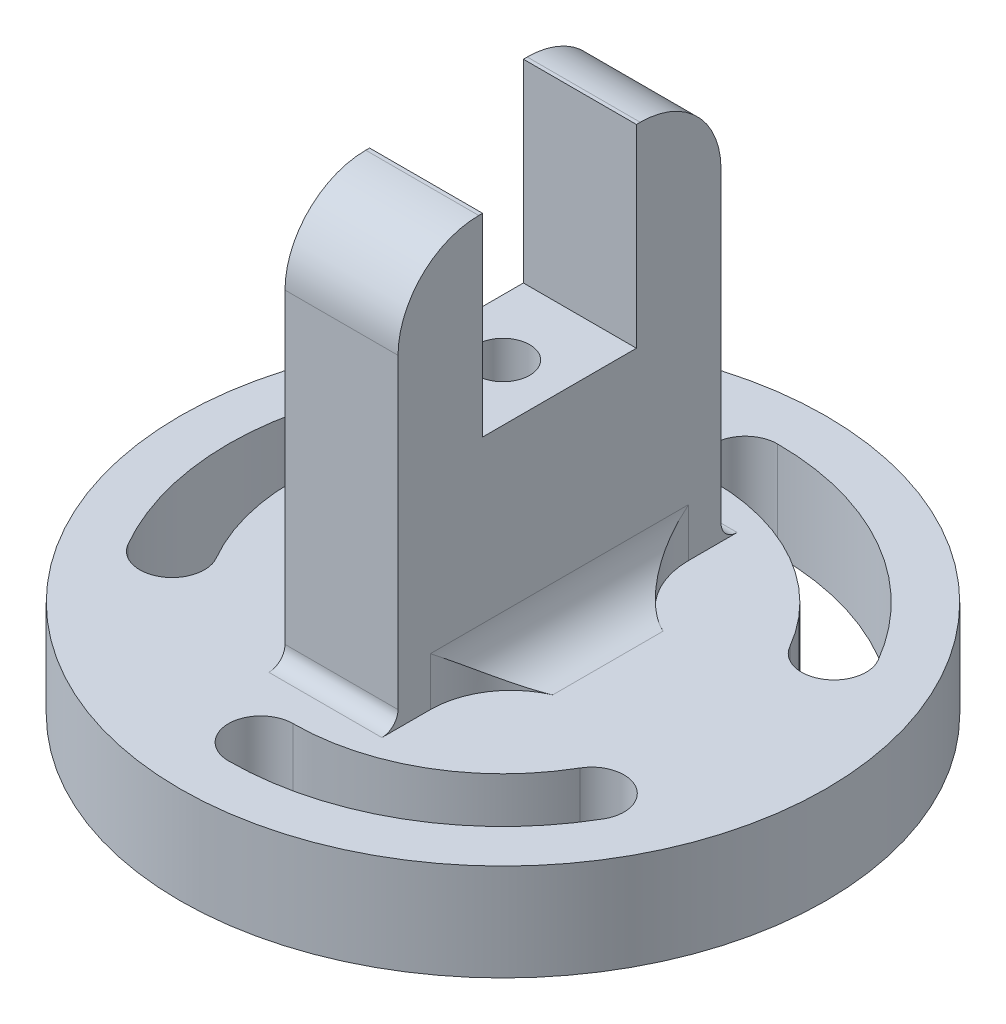
from build123d import *

# Parameters (mm, degrees)
SKETCH1_R                 = 20
BOSS_EXTRUDE1_DEPTH       = 6
CUT_EXTRUDE1_DEPTH        = 29.91366459
CIRPATTERN1_COUNT         = 3
SKETCH3_W                 = 7
SKETCH3_H                 = 20
BOSS_EXTRUDE2_DEPTH       = 25
SKETCH4_W                 = 9.525
SKETCH4_H                 = 12
CUT_EXTRUDE2_DEPTH        = 44.7407133
FILLET1_R                 = 1
FILLET2_R                 = 3
CUT_EXTRUDE3_DEPTH        = 38.749172176
M4X0_7_TAPPED_HOLE1_D     = 3.3
M4X0_7_TAPPED_HOLE1_DEPTH = 8.1
M4X0_7_TAPPED_HOLE1_TIP   = 0.991420021
FILLET3_R                 = 5


with BuildPart() as part:
    # Sketch1 → Boss-Extrude1 (new body)
    with BuildSketch(Plane(origin=(0, 0, 0), x_dir=(1, 0, 0), z_dir=(0, 1, 0))):
        Circle(SKETCH1_R)
    extrude(amount=BOSS_EXTRUDE1_DEPTH)

    # Sketch2 → Cut-Extrude1 (cut, through all)
    with BuildSketch(Plane(origin=(0, 6, 0), x_dir=(1, 0, 0), z_dir=(0, 1, 0))):
        with BuildLine():
            ThreePointArc((0, 17), (-2, 15), (0, 13))
            ThreePointArc((0, 13), (6.5, 11.258330249), (11.258330249, 6.5))
            ThreePointArc((11.258330249, 6.5), (13.990381057, 5.767949192), (14.722431864, 8.5))
            ThreePointArc((14.722431864, 8.5), (8.5, 14.722431864), (0, 17))
        make_face()
    cut_extrude1 = extrude(amount=-CUT_EXTRUDE1_DEPTH, mode=Mode.SUBTRACT)

    # CirPattern1: Cut-Extrude1 ×3 about axis
    cirpattern1_axis = Axis((0, 6, 0), (0, -1, 0))
    for i in range(1, CIRPATTERN1_COUNT):
        add(cut_extrude1.rotate(cirpattern1_axis, i * 360 / CIRPATTERN1_COUNT), mode=Mode.SUBTRACT)

    # Sketch3 → Boss-Extrude2 (add)
    with BuildSketch(Plane(origin=(0, 6, 0), x_dir=(1, 0, 0), z_dir=(0, 1, 0))):
        Rectangle(SKETCH3_W, SKETCH3_H)
    extrude(amount=BOSS_EXTRUDE2_DEPTH)

    # Sketch4 → Cut-Extrude2 (cut, through all)
    with BuildSketch(Plane(origin=(3.5, 0, 0), x_dir=(0, 0, -1), z_dir=(1, 0, 0))):
        with Locations((0, 25)):
            Rectangle(SKETCH4_W, SKETCH4_H)
    extrude(amount=-CUT_EXTRUDE2_DEPTH, mode=Mode.SUBTRACT)

    # Fillet1
    fillet1_edges = [part.edges().sort_by_distance(p)[0] for p in [
        (0, 6, -10),
        (0, 6, 10),
    ]]
    fillet(fillet1_edges, radius=FILLET1_R)

    # Fillet2
    fillet2_edges = [part.edges().sort_by_distance(p)[0] for p in [
        (3.5, 6, 0),
    ]]
    fillet(fillet2_edges, radius=FILLET2_R)
    fillet2_2_edges = [part.edges().sort_by_distance(p)[0] for p in [
        (-3.5, 6, 0),
    ]]
    fillet(fillet2_2_edges, radius=FILLET2_R)

    # Sketch5 → Cut-Extrude3 (cut, through all)
    with BuildSketch(Plane(origin=(0, 6, 0), x_dir=(1, 0, 0), z_dir=(0, 1, 0))):
        with BuildLine():
            Line((-9.5, 13), (-3.5, 13))
            Line((-3.5, 13), (-3.5, 8))
            ThreePointArc((-3.5, 8), (-4.964466094, 4.464466094), (-8.5, 3))
            Line((-8.5, 3), (-9.5, 3))
            Line((-9.5, 3), (-9.5, 13))
        make_face()
        with BuildLine():
            Line((9.5, 3), (8.5, 3))
            ThreePointArc((8.5, 3), (4.964466094, 4.464466094), (3.5, 8))
            Line((3.5, 8), (3.5, 13))
            Line((3.5, 13), (9.5, 13))
            Line((9.5, 13), (9.5, 3))
        make_face()
        with BuildLine():
            Line((9.5, -13), (9.5, -3))
            Line((9.5, -3), (8.5, -3))
            ThreePointArc((8.5, -3), (4.964466094, -4.464466094), (3.5, -8))
            Line((3.5, -8), (3.5, -13))
            Line((3.5, -13), (9.5, -13))
        make_face()
        with BuildLine():
            Line((-3.5, -13), (-3.5, -8))
            ThreePointArc((-3.5, -8), (-4.964466094, -4.464466094), (-8.5, -3))
            Line((-8.5, -3), (-9.5, -3))
            Line((-9.5, -3), (-9.5, -13))
            Line((-9.5, -13), (-3.5, -13))
        make_face()
    extrude(amount=CUT_EXTRUDE3_DEPTH, mode=Mode.SUBTRACT)

    # M4x0.7 Tapped Hole1
    with Locations(Plane(origin=(0, 19, 0), x_dir=(-1, 0, 0), z_dir=(0, 1, 0))):
        with Locations((0, 0)):
            Hole(M4X0_7_TAPPED_HOLE1_D / 2, depth=M4X0_7_TAPPED_HOLE1_DEPTH)
            with Locations((0, 0, -(M4X0_7_TAPPED_HOLE1_DEPTH + M4X0_7_TAPPED_HOLE1_TIP / 2))):  # 118° drill point
                Cone(0, M4X0_7_TAPPED_HOLE1_D / 2, M4X0_7_TAPPED_HOLE1_TIP, mode=Mode.SUBTRACT)

    # Fillet3
    fillet3_edges = [part.edges().sort_by_distance(p)[0] for p in [
        (0, 31, -10),
        (0, 31, 10),
    ]]
    fillet(fillet3_edges, radius=FILLET3_R)


solid = part.part
